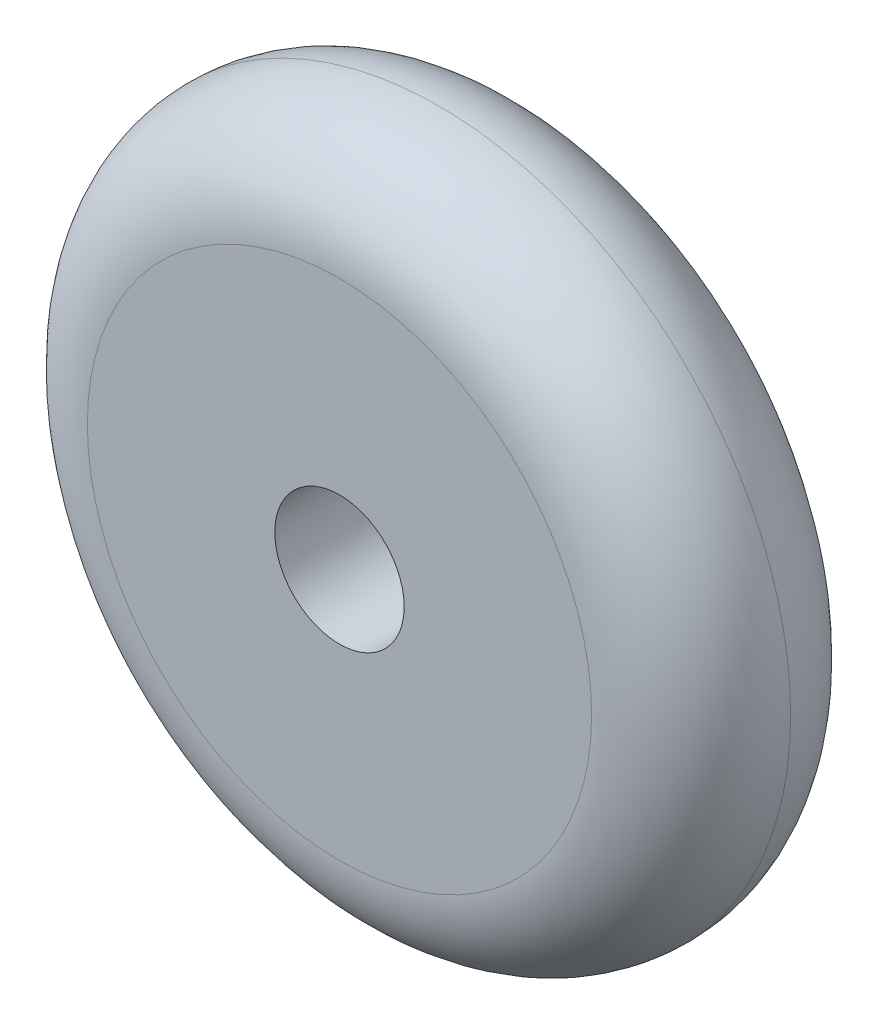
from build123d import *

# Parameters (mm, degrees)
SKETCH_1_R      = 21.2
SKETCH_1_R_2    = 3.9
EXTRUDE_1_DEPTH = 12
FILLET_1_R      = 6
FILLET_2_R      = 6


with BuildPart() as part:
    # 草圖1 → 填料-伸長1 (new body)
    with BuildSketch(Plane.XY):
        Circle(SKETCH_1_R)
        Circle(SKETCH_1_R_2, mode=Mode.SUBTRACT)
    extrude(amount=EXTRUDE_1_DEPTH)

    # 圓角1
    fillet_1_edges = [part.edges().sort_by_distance(p)[0] for p in [
        (-21.2, 0, 12),
    ]]
    fillet(fillet_1_edges, radius=FILLET_1_R)

    # 圓角2
    fillet_2_edges = [part.edges().sort_by_distance(p)[0] for p in [
        (-21.2, 0, 0),
    ]]
    fillet(fillet_2_edges, radius=FILLET_2_R - 0.0001)  # a hair under: the kernel refuses the full size


solid = part.part
